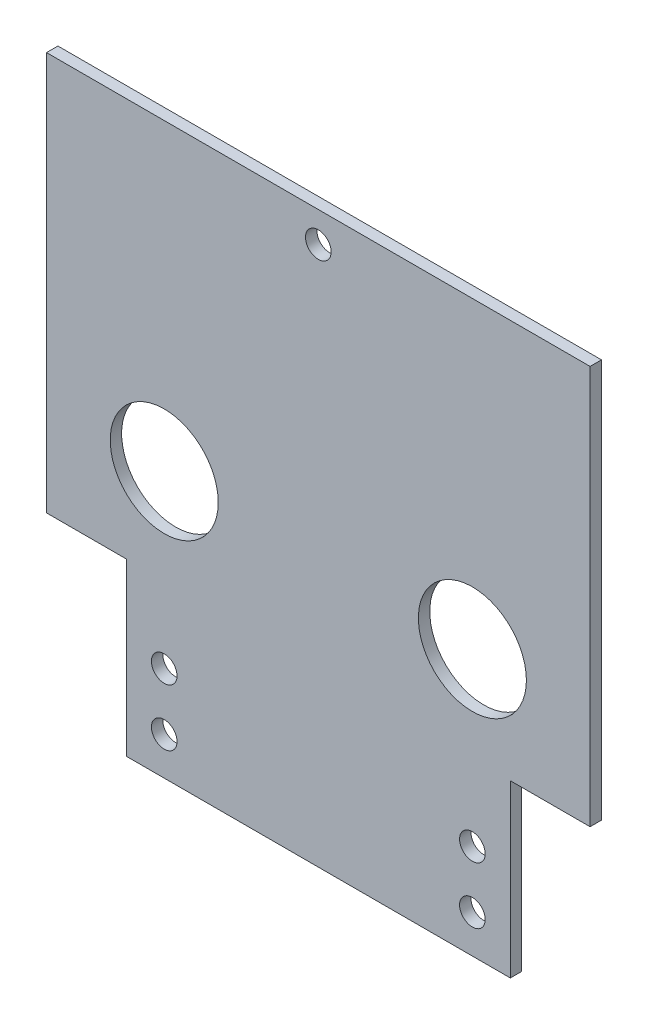
from build123d import *

# Parameters (mm, degrees)
SKETCH1_W           = 143.16
SKETCH1_H           = 150
BOSS_EXTRUDE1_DEPTH = 3
SKETCH2_R           = 14.225
SKETCH2_R_2         = 3.375
CUT_EXTRUDE1_DEPTH  = 208.373541225
SKETCH4_W           = 21
SKETCH4_H           = 45
CUT_EXTRUDE3_DEPTH  = 208.373541225


with BuildPart() as part:
    # Sketch1 → Boss-Extrude1 (new body)
    with BuildSketch(Plane.XY):
        with Locations((71.58, -75)):
            Rectangle(SKETCH1_W, SKETCH1_H)
    extrude(amount=BOSS_EXTRUDE1_DEPTH)

    # Sketch2 → Cut-Extrude1 (cut, through all)
    with BuildSketch(Plane.XY.offset(3)):
        with Locations((31, -80)):
            Circle(SKETCH2_R)
        with Locations((112.16, -80)):
            Circle(SKETCH2_R)
        with Locations((31, -140)):
            Circle(SKETCH2_R_2)
        with Locations((112.16, -140)):
            Circle(SKETCH2_R_2)
        with Locations((71.58, -8)):
            Circle(SKETCH2_R_2)
        with Locations((31, -125)):
            Circle(SKETCH2_R_2)
        with Locations((112.16, -125)):
            Circle(SKETCH2_R_2)
    extrude(amount=-CUT_EXTRUDE1_DEPTH, mode=Mode.SUBTRACT)

    # Sketch4 → Cut-Extrude3 (cut, through all)
    with BuildSketch(Plane.XY.offset(3)):
        with Locations((10.5, -127.5)):
            Rectangle(SKETCH4_W, SKETCH4_H)
        with Locations((132.66, -127.5)):
            Rectangle(SKETCH4_W, SKETCH4_H)
    extrude(amount=-CUT_EXTRUDE3_DEPTH, mode=Mode.SUBTRACT)


solid = part.part
